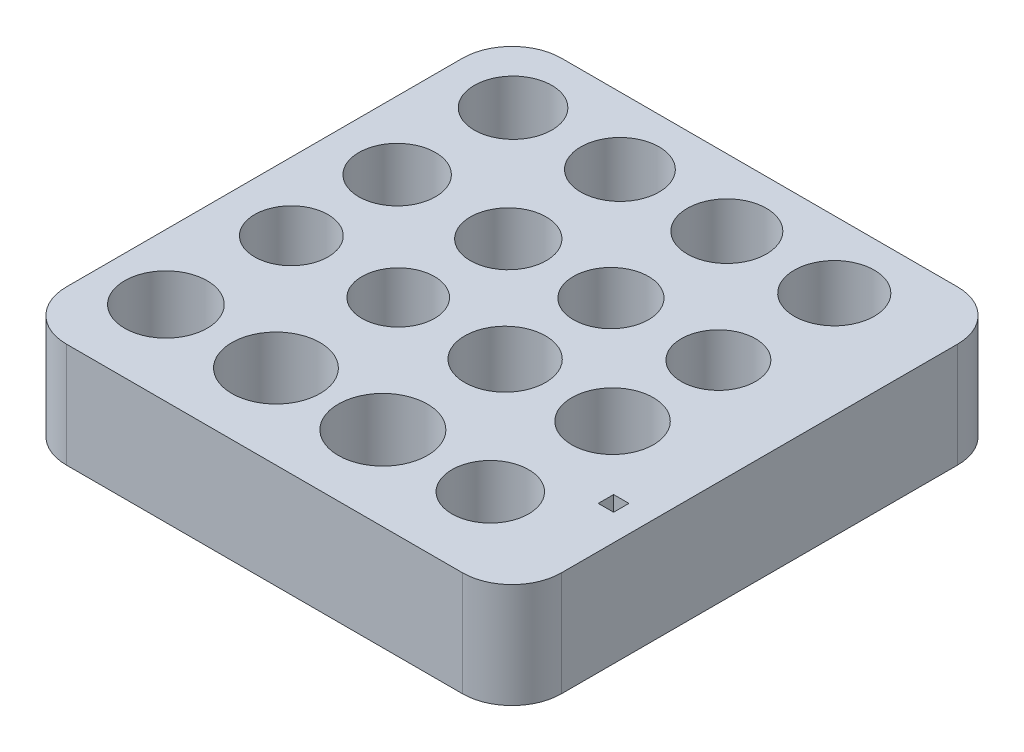
from build123d import *

# Parameters (mm, degrees)
BOSS_EXTRUDE1_DEPTH = 6.35
SKETCH2_R           = 2.35
SKETCH2_R_2         = 2.4
SKETCH2_R_3         = 2.325
SKETCH2_R_4         = 2.275
SKETCH2_R_5         = 2.375
SKETCH2_R_6         = 2.425
SKETCH2_R_7         = 2.3
SKETCH2_R_8         = 2.25
SKETCH2_R_9         = 2.225
SKETCH2_R_10        = 2.2
SKETCH2_R_11        = 2.45
SKETCH2_R_12        = 2.475
SKETCH2_R_13        = 2.5
SKETCH2_R_14        = 2.675
SKETCH2_R_15        = 2.7
SKETCH2_W           = 0.929848637
SKETCH2_H           = 0.929848637
CUT_EXTRUDE1_DEPTH  = 6.35


with BuildPart() as part:
    # Sketch1 → Boss-Extrude1 (new body)
    with BuildSketch(Plane(origin=(0, 0, 0), x_dir=(1, 0, 0), z_dir=(0, 1, 0))):
        with BuildLine():
            Line((3, 0), (27, 0))
            ThreePointArc((27, 0), (29.121320344, 0.878679656), (30, 3))
            Line((30, 3), (30, 27))
            ThreePointArc((30, 27), (29.121320344, 29.121320344), (27, 30))
            Line((27, 30), (3, 30))
            ThreePointArc((3, 30), (0.878679656, 29.121320344), (0, 27))
            Line((0, 27), (0, 3))
            ThreePointArc((0, 3), (0.878679656, 0.878679656), (3, 0))
        make_face()
    extrude(amount=BOSS_EXTRUDE1_DEPTH)

    # Sketch2 → Cut-Extrude1 (cut)
    with BuildSketch(Plane(origin=(0, 6.35, 0), x_dir=(1, 0, 0), z_dir=(0, 1, 0))):
        with Locations((4.130390075, 25.933737418)):
            Circle(SKETCH2_R)
        with Locations((17.084143496, 25.933737418)):
            Circle(SKETCH2_R_2)
        with Locations((4.130390075, 18.911777023)):
            Circle(SKETCH2_R_3)
        with Locations((17.084143496, 18.911777023)):
            Circle(SKETCH2_R_4)
        with Locations((10.607266785, 25.933737418)):
            Circle(SKETCH2_R_5)
        with Locations((23.593083953, 25.933737418)):
            Circle(SKETCH2_R_6)
        with Locations((10.863776754, 18.911777023)):
            Circle(SKETCH2_R_7)
        with Locations((23.593083953, 18.911777023)):
            Circle(SKETCH2_R_8)
        with Locations((4.130390075, 12.499027805)):
            Circle(SKETCH2_R_9)
        with Locations((10.607266785, 12.499027805)):
            Circle(SKETCH2_R_10)
        with Locations((17.084143496, 12.499027805)):
            Circle(SKETCH2_R_11)
        with Locations((23.593083953, 12.499027805)):
            Circle(SKETCH2_R_12)
        with Locations((3.938007598, 5.092302457)):
            Circle(SKETCH2_R_13)
        with Locations((10.607266785, 5.092302457)):
            Circle(SKETCH2_R_14)
        with Locations((17.084143496, 5.092302457)):
            Circle(SKETCH2_R_15)
        with Locations((23.593083953, 5.092302457)):
            Circle(SKETCH2_R_3)
        with Locations((27.937721549, 8.218517702)):
            Rectangle(SKETCH2_W, SKETCH2_H)
    extrude(amount=-CUT_EXTRUDE1_DEPTH, mode=Mode.SUBTRACT)


solid = part.part
